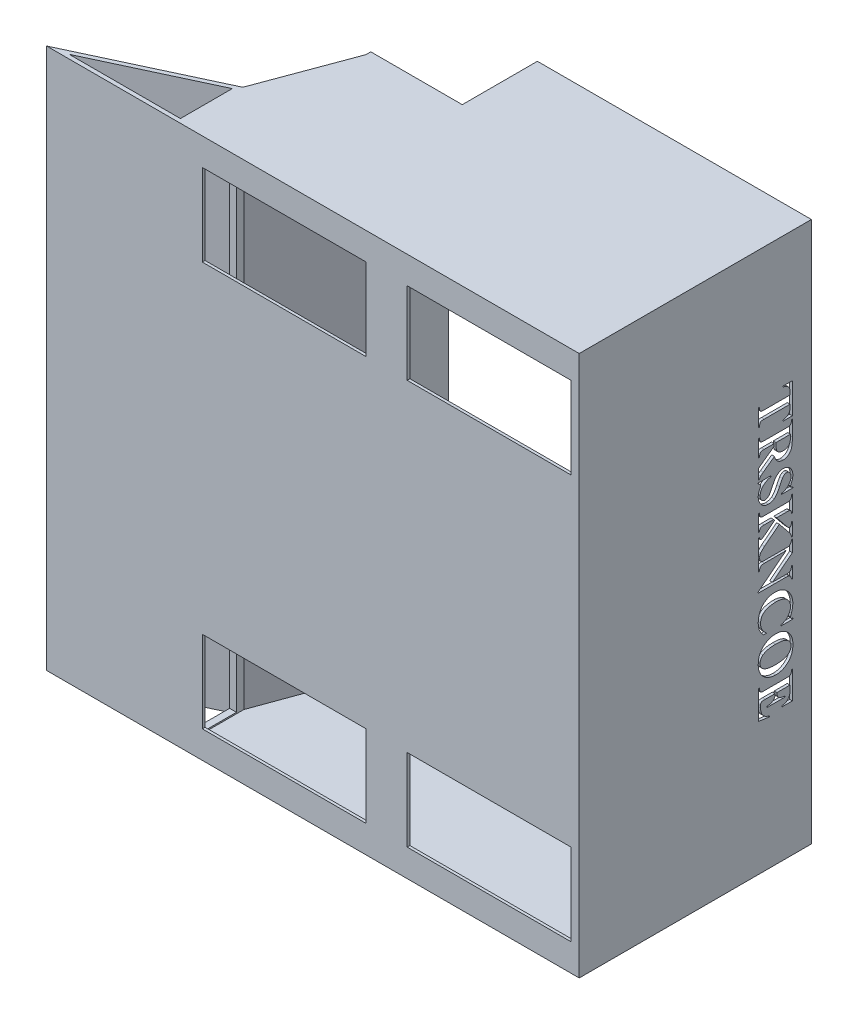
from build123d import *

# Parameters (mm, degrees)
BOSS_EXTRUDE2_DEPTH  = 198
SKETCH5_W            = 60
SKETCH5_H            = 30
CUT_EXTRUDE5_DEPTH   = 33
BOSS_EXTRUDE5_DEPTH  = 198
BOSS_EXTRUDE6_DEPTH  = 1.5
BOSS_EXTRUDE7_DEPTH  = 1.5
SKETCH12_W           = 10
SKETCH12_H           = 30
CUT_EXTRUDE8_DEPTH   = 2.5
SKETCH13_W           = 133.813801543
SKETCH13_H           = 25
CUT_EXTRUDE9_DEPTH   = 200
CUT_EXTRUDE13_DEPTH  = 301
SKETCH20_W           = 18
SKETCH20_H           = 194
CUT_EXTRUDE14_DEPTH  = 3
CUT_EXTRUDE16_DEPTH  = 10
CUT_EXTRUDE17_DEPTH  = 29
BOSS_EXTRUDE8_DEPTH  = 29
BOSS_EXTRUDE10_DEPTH = 1.5
SKETCH27_W           = 10
SKETCH27_H           = 30
CUT_EXTRUDE18_DEPTH  = 1.5
SKETCH29_W           = 10
SKETCH29_H           = 30
CUT_EXTRUDE19_DEPTH  = 1.5


with BuildPart() as part:
    # Sketch1 → Boss-Extrude2 (new body)
    with BuildSketch(Plane(origin=(0, 0, 0), x_dir=(1, 0, 0), z_dir=(0, 1, 0))):
        Polygon((-61.934971554, -72.496387141), (-16.445680057, -51.284382152), (-4.2594816, -17.803077062), (-4.2594816, 36.503612859), (-5.2594816, 36.503612859), (-5.2594816, -17.803077062), (-17.445680057, -50.647311892), (-66.445680057, -73.496387141), (128.554319943, -73.496387141), (128.554319943, 36.503612859), (127.554319943, 35.503612859), (127.554319943, -72.496387141), align=None)
    extrude(amount=BOSS_EXTRUDE2_DEPTH)

    # Sketch5 → Cut-Extrude5 (cut)
    with BuildSketch(Plane(origin=(0, 0, 72.496387141), x_dir=(-1, 0, 0), z_dir=(0, 0, -1))):
        with Locations((-95.554319943, 173)):
            Rectangle(SKETCH5_W, SKETCH5_H)
        with Locations((-20.554319943, 173)):
            Rectangle(SKETCH5_W, SKETCH5_H)
        with Locations((-95.554319943, 25)):
            Rectangle(SKETCH5_W, SKETCH5_H)
        with Locations((-20.554319943, 25)):
            Rectangle(SKETCH5_W, SKETCH5_H)
    extrude(amount=-CUT_EXTRUDE5_DEPTH, mode=Mode.SUBTRACT)

    # Sketch8 → Boss-Extrude5 (add)
    with BuildSketch(Plane(origin=(0, 0, 0), x_dir=(-1, 0, 0), z_dir=(0, -1, 0))):
        Polygon((16.445680057, -51.284382152), (16.445680057, -72.496387141), (61.934971554, -72.496387141), align=None)
    extrude(amount=-BOSS_EXTRUDE5_DEPTH)

    # Sketch10 → Boss-Extrude6 (add)
    with BuildSketch(Plane(origin=(0, 198, 0), x_dir=(1, 0, 0), z_dir=(0, 1, 0))):
        Polygon((127.554319943, -72.496387141), (127.554319943, 35.503612859), (128.554319943, 36.503612859), (-4.2594816, 36.503612859), (-4.2594816, -17.803077062), (-16.445680057, -51.284382152), (-16.445680057, -72.496387141), align=None)
    extrude(amount=-BOSS_EXTRUDE6_DEPTH)

    # Sketch11 → Boss-Extrude7 (add)
    with BuildSketch(Plane(origin=(0, 0, 0), x_dir=(-1, 0, 0), z_dir=(0, -1, 0))):
        Polygon((4.2594816, 36.503612859), (4.2594816, -17.803077062), (16.445680057, -51.284382152), (16.445680057, -72.496387141), (-127.554319943, -72.496387141), (-127.554319943, 35.503612859), (-128.554319943, 36.503612859), align=None)
    extrude(amount=-BOSS_EXTRUDE7_DEPTH)

    # Sketch12 → Cut-Extrude8 (cut)
    with BuildSketch(Plane.ZY.offset(5.2594816)):
        with Locations((11.496387141, 99)):
            Rectangle(SKETCH12_W, SKETCH12_H)
    extrude(amount=-CUT_EXTRUDE8_DEPTH, mode=Mode.SUBTRACT)

    # Sketch13 → Cut-Extrude9 (cut)
    with BuildSketch(Plane(origin=(0, 198, 0), x_dir=(1, 0, 0), z_dir=(0, 1, 0))):
        with Locations((61.647419171, 24.003612859)):
            Rectangle(SKETCH13_W, SKETCH13_H)
    extrude(amount=-CUT_EXTRUDE9_DEPTH, mode=Mode.SUBTRACT)

    # Sketch19 → Cut-Extrude13 (cut)
    with BuildSketch(Plane(origin=(0, 0, 0), x_dir=(-1, 0, 0), z_dir=(0, -1, 0))):
        Polygon((59.679617302, -71.996387141), (18.945680057, -71.996387141), (18.945680057, -53.001840257), align=None)
    extrude(amount=-CUT_EXTRUDE13_DEPTH, mode=Mode.SUBTRACT)

    # Sketch20 → Cut-Extrude14 (cut)
    with BuildSketch(Plane(origin=(-16.445680057, 0, 0), x_dir=(0, 0, -1), z_dir=(1, 0, 0))):
        with Locations((-62.996387141, 99)):
            Rectangle(SKETCH20_W, SKETCH20_H)
    extrude(amount=-CUT_EXTRUDE14_DEPTH, mode=Mode.SUBTRACT)

    # Sketch22 → Cut-Extrude16 (cut)
    # profile 1 of 8: a face of its own
    with BuildSketch(Plane(origin=(128.554319943, 0, 0), x_dir=(0, 0, -1), z_dir=(1, 0, 0))):
        with BuildLine():
            Line((4.532708535, 139.23699273), (1.108283622, 139.23699273))
            Line((1.108283622, 139.23699273), (1.108283622, 139.579435221))
            add(Edge.make_bspline(
                [(1.108283622, 139.579435221), (1.283727047, 139.625369692), (1.6114492, 139.711173669), (2.057569025, 139.862804818), (2.427571695, 140.017409192), (2.725039365, 140.190704227), (2.971397315, 140.385135725), (3.179215664, 140.61055841), (3.367807428, 140.862653524), (3.466009727, 141.051094846), (3.516082389, 141.147179752)],
                knots=[0, 0, 0, 0, 1.456789678, 2.721231939, 3.783509113, 4.673258435, 5.479000225, 6.295157497, 7.130712789, 8, 8, 8, 8], degree=3))
            add(Edge.make_bspline(
                [(3.516082389, 141.147179752), (3.541258402, 141.212592895), (3.598476255, 141.361258197), (3.642844061, 141.626322478), (3.671328394, 141.951760613), (3.674743728, 142.189565138), (3.676602307, 142.318975152)],
                knots=[0, 0, 0, 0, 0.705326227, 1.603004102, 2.695587181, 4, 4, 4, 4], degree=3))
            Line((3.676602307, 142.318975152), (3.676602307, 143.346302626))
            Line((3.676602307, 143.346302626), (-5.740566204, 143.346302626))
            add(Edge.make_bspline(
                [(-5.740566204, 143.346302626), (-5.812795026, 143.345263702), (-5.951011668, 143.343275623), (-6.147327182, 143.342748047), (-6.322070378, 143.333435506), (-6.47579109, 143.324581732), (-6.6074858, 143.307088211), (-6.719653643, 143.292810872), (-6.809273737, 143.272254265), (-6.901428046, 143.240225155), (-6.996317414, 143.180939376), (-7.103429506, 143.095281356), (-7.198567805, 142.98021221), (-7.287981424, 142.843159412), (-7.36289385, 142.679725819), (-7.416270639, 142.487661246), (-7.447237148, 142.269155551), (-7.450874242, 142.113970885), (-7.452778661, 142.032714632)],
                knots=[0, 0, 0, 0, 1.352332734, 2.587815859, 3.674093584, 4.62800279, 5.468700902, 6.160453175, 6.743556292, 7.187132044, 7.980238029, 8.822426595, 9.745903759, 10.759998733, 11.880501272, 13.095856917, 14.479361463, 16, 16, 16, 16], degree=3))
            Line((-7.452778661, 142.032714632), (-7.452778661, 141.634090169))
            Line((-7.452778661, 141.634090169), (-7.795221152, 141.634090169))
            Line((-7.795221152, 141.634090169), (-7.795221152, 147.969276259))
            Line((-7.795221152, 147.969276259), (-7.452778661, 147.969276259))
            Line((-7.452778661, 147.969276259), (-7.452778661, 147.567976464))
            add(Edge.make_bspline(
                [(-7.452778661, 147.567976464), (-7.451177078, 147.484002318), (-7.448128564, 147.324162761), (-7.413192523, 147.097706397), (-7.355965173, 146.896125346), (-7.296697088, 146.777143385), (-7.268180755, 146.719896232)],
                knots=[0, 0, 0, 0, 1.147815573, 2.184795468, 3.126629849, 4, 4, 4, 4], degree=3))
            add(Edge.make_bspline(
                [(-7.268180755, 146.719896232), (-7.245527744, 146.682261264), (-7.199705916, 146.606134388), (-7.101704377, 146.508668436), (-6.984268883, 146.423026842), (-6.894407147, 146.378810209), (-6.848153637, 146.356051085)],
                knots=[0, 0, 0, 0, 0.928829741, 1.878808762, 2.908183361, 4, 4, 4, 4], degree=3))
            add(Edge.make_bspline(
                [(-6.848153637, 146.356051085), (-6.82696283, 146.347312771), (-6.778691025, 146.327407246), (-6.692125509, 146.312607489), (-6.586754108, 146.291147537), (-6.45853416, 146.280318282), (-6.308770082, 146.269393816), (-6.138385377, 146.260878411), (-5.946560431, 146.259985379), (-5.811905735, 146.258075597), (-5.740566204, 146.257063802)],
                knots=[0, 0, 0, 0, 0.491154816, 1.118830903, 1.878082211, 2.802823963, 3.878617243, 5.106317376, 6.466938293, 8, 8, 8, 8], degree=3))
            Line((-5.740566204, 146.257063802), (3.676602307, 146.257063802))
            Line((3.676602307, 146.257063802), (3.676602307, 147.284391276))
            add(Edge.make_bspline(
                [(3.676602307, 147.284391276), (3.675209474, 147.382541865), (3.672533176, 147.571135998), (3.648051684, 147.843749081), (3.608486076, 148.095994854), (3.553386758, 148.328099904), (3.48140098, 148.540398485), (3.389593011, 148.729432323), (3.286819616, 148.901505483), (3.201857304, 148.999473778), (3.160263238, 149.04743504)],
                knots=[0, 0, 0, 0, 1.253047779, 2.407702914, 3.491633713, 4.510764096, 5.450666339, 6.347071276, 7.190793839, 8, 8, 8, 8], degree=3))
            add(Edge.make_bspline(
                [(3.160263238, 149.04743504), (3.098232731, 149.110379856), (2.973774304, 149.23667276), (2.762057505, 149.401886271), (2.534663557, 149.55260774), (2.286649074, 149.684671003), (2.018692926, 149.795052717), (1.733365207, 149.892947914), (1.428181165, 149.97042517), (1.216486, 150.005833286), (1.108283622, 150.023931207)],
                knots=[0, 0, 0, 0, 0.914922114, 1.835705892, 2.776354923, 3.739610741, 4.741925865, 5.776441286, 6.863486844, 8, 8, 8, 8], degree=3))
            Line((1.108283622, 150.023931207), (1.108283622, 150.366373698))
            Line((1.108283622, 150.366373698), (4.532708535, 150.366373698))
            Line((4.532708535, 150.366373698), (4.532708535, 139.23699273))
        make_face()
    # profile 2 of 8: a face of its own
    with BuildSketch(Plane(origin=(128.554319943, 0, 0), x_dir=(0, 0, -1), z_dir=(1, 0, 0))):
        with BuildLine():
            Line((-2.144920045, 133.757912869), (-5.740566204, 133.757912869))
            add(Edge.make_bspline(
                [(-5.740566204, 133.757912869), (-5.814587919, 133.757254909), (-5.956407099, 133.755994315), (-6.15796856, 133.750541404), (-6.338260564, 133.743466374), (-6.496325162, 133.730608761), (-6.63283574, 133.711807615), (-6.748005293, 133.690584459), (-6.842913922, 133.668404638), (-6.93907565, 133.629081364), (-7.039557625, 133.564530452), (-7.145181407, 133.467172514), (-7.236336091, 133.344237703), (-7.317399153, 133.193124852), (-7.384358347, 132.996374977), (-7.419860952, 132.737789677), (-7.451520192, 132.414784285), (-7.452334288, 132.176026219), (-7.452778661, 132.045700412)],
                knots=[0, 0, 0, 0, 1.201644639, 2.3022468, 3.273150526, 4.130331253, 4.875559622, 5.508734867, 6.031899083, 6.453960745, 7.188995541, 7.957346903, 8.773832027, 9.661165858, 10.732433931, 12.127079426, 13.885970896, 16, 16, 16, 16], degree=3))
            Line((-7.452778661, 132.045700412), (-7.795221152, 132.045700412))
            Line((-7.795221152, 132.045700412), (-7.795221152, 138.209665256))
            Line((-7.795221152, 138.209665256), (-7.452778661, 138.209665256))
            add(Edge.make_bspline(
                [(-7.452778661, 138.209665256), (-7.452218331, 138.078479095), (-7.451194973, 137.838887048), (-7.42095196, 137.513601944), (-7.380902403, 137.254992361), (-7.316230896, 137.056530211), (-7.230596591, 136.908983813), (-7.13923606, 136.787745008), (-7.034503841, 136.691788675), (-6.935877857, 136.625686063), (-6.840965293, 136.58747001), (-6.747232609, 136.564467922), (-6.633030656, 136.542723787), (-6.495919734, 136.529337867), (-6.338491698, 136.510419896), (-6.157920856, 136.505300804), (-5.956420986, 136.499232626), (-5.814592682, 136.498063183), (-5.740566204, 136.497452799)],
                knots=[0, 0, 0, 0, 2.130193463, 3.890482125, 5.302978532, 6.375097578, 7.257445176, 8.06306665, 8.83202836, 9.555418243, 9.977815174, 10.487376127, 11.121054341, 11.86504307, 12.724249415, 13.695924388, 14.797400823, 16, 16, 16, 16], degree=3))
            Line((-5.740566204, 136.497452799), (2.478053588, 136.497452799))
            add(Edge.make_bspline(
                [(2.478053588, 136.497452799), (2.552080184, 136.498062767), (2.693908715, 136.499231411), (2.895407053, 136.505304979), (3.075982774, 136.510406905), (3.233395722, 136.529377955), (3.370552171, 136.542603712), (3.485469006, 136.564978814), (3.580404921, 136.586924022), (3.676564575, 136.626299495), (3.777020067, 136.690841835), (3.882769989, 136.788145764), (3.972938255, 136.910695928), (4.056448067, 137.060671146), (4.12026207, 137.258699147), (4.162228776, 137.516967267), (4.187357733, 137.840864952), (4.189238887, 138.079412351), (4.190266044, 138.209665256)],
                knots=[0, 0, 0, 0, 1.201515742, 2.301999846, 3.272799427, 4.131231703, 4.874550165, 5.507657491, 6.030765589, 6.452781978, 7.18773793, 7.956006874, 8.772404417, 9.64691745, 10.731773378, 12.128746246, 13.88619766, 16, 16, 16, 16], degree=3))
            Line((4.190266044, 138.209665256), (4.532708535, 138.209665256))
            Line((4.532708535, 138.209665256), (4.532708535, 132.50585751))
            add(Edge.make_bspline(
                [(4.532708535, 132.50585751), (4.531484518, 132.326604095), (4.5291153, 131.979639786), (4.516601993, 131.478291984), (4.492824315, 131.014383431), (4.458710796, 130.587827226), (4.413242605, 130.198895961), (4.360955549, 129.845991868), (4.29720921, 129.531749445), (4.225017741, 129.249727188), (4.137291993, 128.993467249), (4.036167095, 128.751234727), (3.915931874, 128.522833637), (3.780330643, 128.305292831), (3.628557155, 128.100171262), (3.458673395, 127.905884271), (3.271685321, 127.725296681), (3.07121296, 127.556367577), (2.85836136, 127.403475629), (2.632438526, 127.273241304), (2.399777158, 127.159530504), (2.156685727, 127.068691796), (1.905559841, 126.995990516), (1.644164075, 126.945097704), (1.373816297, 126.915783317), (1.190397407, 126.911321067), (1.097582294, 126.909063043)],
                knots=[0, 0, 0, 0, 1.726483433, 3.341794804, 4.829708898, 6.19992401, 7.462396709, 8.600599068, 9.634857001, 10.549418861, 11.402289802, 12.241382758, 13.0750512, 13.88534005, 14.708186664, 15.529911836, 16.368125147, 17.209413191, 18.053109236, 18.888368986, 19.718134714, 20.544470446, 21.384486037, 22.233455642, 23.106078906, 24, 24, 24, 24], degree=3))
            add(Edge.make_bspline(
                [(1.097582294, 126.909063043), (0.985071758, 126.91226052), (0.764460915, 126.918530139), (0.440568627, 126.964549958), (0.132423, 127.042536194), (-0.16179332, 127.14902856), (-0.438833355, 127.290403481), (-0.702899565, 127.459846545), (-0.95286794, 127.660317326), (-1.103114244, 127.815219033), (-1.179125207, 127.893585205)],
                knots=[0, 0, 0, 0, 1.055875917, 2.070363217, 3.063103869, 4.034981426, 5.000784238, 5.975972407, 6.976026164, 8, 8, 8, 8], degree=3))
            add(Edge.make_bspline(
                [(-1.179125207, 127.893585205), (-1.272100997, 128.005989439), (-1.465054968, 128.239263533), (-1.689867872, 128.656952967), (-1.887612315, 129.129865905), (-1.982861985, 129.472511558), (-2.032556103, 129.651278305)],
                knots=[0, 0, 0, 0, 0.885719489, 1.838146155, 2.87210716, 4, 4, 4, 4], degree=3))
            Line((-2.032556103, 129.651278305), (-6.128489339, 126.684335158))
            add(Edge.make_bspline(
                [(-6.128489339, 126.684335158), (-6.19284906, 126.639064874), (-6.316736874, 126.551922849), (-6.490886464, 126.424403554), (-6.648337797, 126.309373987), (-6.783868431, 126.202021483), (-6.901908169, 126.107060804), (-6.999450292, 126.019802792), (-7.078904404, 125.944757808), (-7.123078837, 125.895360176), (-7.142440153, 125.873709573)],
                knots=[0, 0, 0, 0, 1.451918146, 2.794837519, 3.982947617, 5.049517129, 5.985027272, 6.777632289, 7.464245587, 8, 8, 8, 8], degree=3))
            add(Edge.make_bspline(
                [(-7.142440153, 125.873709573), (-7.186586527, 125.811708767), (-7.274586021, 125.688119013), (-7.366769331, 125.478967971), (-7.430913443, 125.257428826), (-7.445419536, 125.103645547), (-7.452778661, 125.02562934)],
                knots=[0, 0, 0, 0, 0.994168701, 1.981733386, 2.976107756, 4, 4, 4, 4], degree=3))
            Line((-7.452778661, 125.02562934), (-7.795221152, 125.02562934))
            Line((-7.795221152, 125.02562934), (-7.795221152, 128.819250064))
            Line((-7.795221152, 128.819250064), (-2.144920045, 132.909832637))
            Line((-2.144920045, 132.909832637), (-2.144920045, 133.757912869))
        make_face()
        with BuildLine():
            Line((3.847823553, 133.757912869), (-1.460035063, 133.757912869))
            Line((-1.460035063, 133.757912869), (-1.460035063, 133.21482048))
            add(Edge.make_bspline(
                [(-1.460035063, 133.21482048), (-1.459744782, 133.107799135), (-1.45918341, 132.900830989), (-1.448558621, 132.600146102), (-1.429531706, 132.320989794), (-1.406196529, 132.062096866), (-1.374932563, 131.824481365), (-1.333770944, 131.607045052), (-1.290514188, 131.409780819), (-1.219444055, 131.178893226), (-1.106051828, 130.917501129), (-0.921829557, 130.636501034), (-0.687646466, 130.39461193), (-0.411356227, 130.18494468), (-0.086939507, 130.018233862), (0.283956309, 129.902206597), (0.698139288, 129.832602951), (0.988497103, 129.824213084), (1.140387606, 129.819824219)],
                knots=[0, 0, 0, 0, 1.034149226, 1.999937005, 2.906794707, 3.737712964, 4.511620493, 5.221514996, 5.875829492, 6.461890401, 7.553881478, 8.617484609, 9.690230081, 10.791566161, 11.955549912, 13.195557958, 14.532954548, 16, 16, 16, 16], degree=3))
            add(Edge.make_bspline(
                [(1.140387606, 129.819824219), (1.251947192, 129.821731832), (1.468420627, 129.825433419), (1.781435774, 129.858039829), (2.072997563, 129.909809372), (2.340964164, 129.988782476), (2.588412435, 130.083706088), (2.813518536, 130.201200019), (3.011678899, 130.345395953), (3.192584611, 130.506772634), (3.347720781, 130.696284065), (3.483044468, 130.911113527), (3.597825281, 131.151482507), (3.687743385, 131.4197771), (3.759349386, 131.712474869), (3.813390244, 132.030598281), (3.84134376, 132.37604571), (3.845607387, 132.614609619), (3.847823553, 132.738611391)],
                knots=[0, 0, 0, 0, 1.164130753, 2.258912866, 3.281299513, 4.250478917, 5.170069284, 6.044502933, 6.891761094, 7.722026402, 8.568210108, 9.438472197, 10.366923691, 11.341274467, 12.386541005, 13.509761723, 14.705613267, 16, 16, 16, 16], degree=3))
            Line((3.847823553, 132.738611391), (3.847823553, 133.757912869))
        make_face(mode=Mode.SUBTRACT)
    # profile 3 of 8: a face of its own
    with BuildSketch(Plane(origin=(128.554319943, 0, 0), x_dir=(0, 0, -1), z_dir=(1, 0, 0))):
        with BuildLine():
            Line((4.703929781, 116.293345812), (0.594619885, 116.293345812))
            Line((0.594619885, 116.293345812), (0.594619885, 116.635788303))
            add(Edge.make_bspline(
                [(0.594619885, 116.635788303), (0.720842095, 116.660503273), (0.968421699, 116.708980656), (1.326651295, 116.815557966), (1.666976699, 116.943143338), (1.988567103, 117.095593822), (2.291178769, 117.272652606), (2.571316989, 117.478524448), (2.83911438, 117.701608502), (3.079616961, 117.95437978), (3.299642124, 118.21740786), (3.491439156, 118.490687724), (3.655316073, 118.767187179), (3.787088281, 119.051802462), (3.892980037, 119.339375127), (3.964016012, 119.634901615), (4.012748088, 119.933737755), (4.01694696, 120.135820591), (4.019044798, 120.236785126)],
                knots=[0, 0, 0, 0, 1.144647834, 2.245179015, 3.323223498, 4.378092962, 5.410336142, 6.439551446, 7.47048058, 8.509329745, 9.541236932, 10.521538389, 11.478900123, 12.398951312, 13.310707536, 14.20236123, 15.101864541, 16, 16, 16, 16], degree=3))
            add(Edge.make_bspline(
                [(4.019044798, 120.236785126), (4.01420831, 120.386242065), (4.004955281, 120.672178704), (3.912601342, 121.077276459), (3.760775018, 121.43501561), (3.546187187, 121.733734593), (3.301193938, 121.979746675), (3.025249872, 122.153625176), (2.730912154, 122.26718974), (2.525435928, 122.279755835), (2.421871616, 122.28608941)],
                knots=[0, 0, 0, 0, 1.240386588, 2.373071298, 3.43189099, 4.447686075, 5.412023421, 6.298205506, 7.142260017, 8, 8, 8, 8], degree=3))
            add(Edge.make_bspline(
                [(2.421871616, 122.28608941), (2.35746479, 122.283402797), (2.230228379, 122.278095363), (2.045741637, 122.239609577), (1.870325639, 122.179193637), (1.765501027, 122.116762386), (1.712908646, 122.085439512)],
                knots=[0, 0, 0, 0, 1.034510543, 2.043687212, 3.018482926, 4, 4, 4, 4], degree=3))
            add(Edge.make_bspline(
                [(1.712908646, 122.085439512), (1.641979803, 122.034494991), (1.493599782, 121.92792129), (1.287237899, 121.724546487), (1.081865311, 121.481454954), (0.955125568, 121.298283601), (0.888906401, 121.202579965)],
                knots=[0, 0, 0, 0, 0.861243433, 1.801683407, 2.851420335, 4, 4, 4, 4], degree=3))
            add(Edge.make_bspline(
                [(0.888906401, 121.202579965), (0.861732469, 121.160026158), (0.800378904, 121.063947766), (0.708348104, 120.896504817), (0.598775617, 120.694487724), (0.475628147, 120.455470481), (0.339223948, 120.179853715), (0.190839229, 119.866604407), (0.023520981, 119.519023802), (-0.089730283, 119.27383403), (-0.149122401, 119.145249685)],
                knots=[0, 0, 0, 0, 0.525425385, 1.186310459, 1.987890453, 2.917855787, 3.984737341, 5.188781275, 6.525718604, 8, 8, 8, 8], degree=3))
            add(Edge.make_bspline(
                [(-0.149122401, 119.145249685), (-0.233403314, 118.964463071), (-0.395384648, 118.617005317), (-0.649814687, 118.127079732), (-0.900216033, 117.687078817), (-1.148996943, 117.299053495), (-1.391094436, 116.959128641), (-1.633233127, 116.671966863), (-1.867627723, 116.428721066), (-2.038008244, 116.302090199), (-2.118166726, 116.242514504)],
                knots=[0, 0, 0, 0, 1.351302326, 2.59709756, 3.739211266, 4.780014725, 5.719093837, 6.563872535, 7.324348837, 8, 8, 8, 8], degree=3))
            add(Edge.make_bspline(
                [(-2.118166726, 116.242514504), (-2.196787731, 116.191352859), (-2.352333357, 116.090133468), (-2.598069716, 115.960222979), (-2.853590913, 115.854864704), (-3.115305188, 115.76222713), (-3.387426532, 115.692343806), (-3.667704649, 115.645710952), (-3.956330417, 115.614823363), (-4.151338011, 115.61060424), (-4.250406301, 115.608460829)],
                knots=[0, 0, 0, 0, 0.996344776, 1.971191697, 2.947878822, 3.930751197, 4.918952808, 5.928367894, 6.947563805, 8, 8, 8, 8], degree=3))
            add(Edge.make_bspline(
                [(-4.250406301, 115.608460829), (-4.375457247, 115.611996855), (-4.622390984, 115.618979322), (-4.985060892, 115.676281025), (-5.333093737, 115.771778669), (-5.670222714, 115.898915119), (-5.991262692, 116.070351442), (-6.30229719, 116.273946827), (-6.595531111, 116.519934689), (-6.875324025, 116.796015038), (-7.131425989, 117.101339913), (-7.353014438, 117.43260835), (-7.546123926, 117.780989048), (-7.696739397, 118.153015067), (-7.818859223, 118.541911372), (-7.902683288, 118.951609773), (-7.959269824, 119.380878398), (-7.96401856, 119.674774391), (-7.966442398, 119.824784003)],
                knots=[0, 0, 0, 0, 0.958291041, 1.89230385, 2.806082205, 3.721470248, 4.648022591, 5.590379525, 6.566357341, 7.576687834, 8.600801837, 9.615217942, 10.627858716, 11.64859008, 12.686507178, 13.748417553, 14.85075326, 16, 16, 16, 16], degree=3))
            add(Edge.make_bspline(
                [(-7.966442398, 119.824784003), (-7.959515651, 120.011568467), (-7.945926008, 120.378022492), (-7.860944071, 120.833706654), (-7.748910255, 121.200636621), (-7.630403529, 121.504961003), (-7.491198457, 121.845094079), (-7.378342719, 122.078023073), (-7.319012063, 122.200478787)],
                knots=[0, 0, 0, 0, 1.351813776, 2.652134936, 3.340338297, 4.126880753, 5.015261474, 6, 6, 6, 6], degree=3))
            add(Edge.make_bspline(
                [(-7.319012063, 122.200478787), (-7.287745474, 122.268742876), (-7.228868229, 122.397289085), (-7.160482045, 122.583386147), (-7.120091104, 122.752558809), (-7.113452244, 122.859327743), (-7.110336169, 122.909441757)],
                knots=[0, 0, 0, 0, 1.209867191, 2.278267276, 3.191872249, 4, 4, 4, 4], degree=3))
            add(Edge.make_bspline(
                [(-7.110336169, 122.909441757), (-7.112918776, 122.949938136), (-7.118207039, 123.03286036), (-7.163540506, 123.155751478), (-7.22725151, 123.283326029), (-7.322608627, 123.410268824), (-7.44132692, 123.536447481), (-7.591250822, 123.648545361), (-7.767121196, 123.749098294), (-7.897876428, 123.800254905), (-7.966442398, 123.827080621)],
                knots=[0, 0, 0, 0, 0.729660239, 1.494085464, 2.344550278, 3.301897717, 4.35052023, 5.465754661, 6.671081929, 8, 8, 8, 8], degree=3))
            Line((-7.966442398, 123.827080621), (-7.966442398, 124.169523112))
            Line((-7.966442398, 124.169523112), (-3.343468765, 124.169523112))
            Line((-3.343468765, 124.169523112), (-3.343468765, 123.827080621))
            add(Edge.make_bspline(
                [(-3.343468765, 123.827080621), (-3.499260025, 123.791985316), (-3.804792961, 123.723157505), (-4.242826745, 123.5821391), (-4.653324845, 123.422144225), (-5.036213016, 123.241211747), (-5.387923987, 123.030804465), (-5.712209325, 122.798417086), (-6.008771115, 122.542536374), (-6.275803744, 122.265781844), (-6.507918997, 121.971127636), (-6.717407993, 121.674138619), (-6.891248847, 121.36829455), (-7.034103186, 121.056941415), (-7.144887876, 120.739886266), (-7.221567471, 120.417049633), (-7.272589059, 120.089474133), (-7.278561331, 119.86867036), (-7.281557415, 119.757900704)],
                knots=[0, 0, 0, 0, 1.248177424, 2.447886446, 3.593885666, 4.691755401, 5.754906139, 6.794118607, 7.807629517, 8.813700699, 9.796001908, 10.738024902, 11.653105301, 12.542423343, 13.413511193, 14.274379661, 15.134315643, 16, 16, 16, 16], degree=3))
            add(Edge.make_bspline(
                [(-7.281557415, 119.757900704), (-7.280414104, 119.673973036), (-7.278169958, 119.50923573), (-7.248995885, 119.270051837), (-7.211802217, 119.041654128), (-7.148412333, 118.829631797), (-7.074188034, 118.628058956), (-6.98004457, 118.441086056), (-6.870034762, 118.266262917), (-6.744734295, 118.105495155), (-6.605940203, 117.964030909), (-6.464712124, 117.835160075), (-6.313482746, 117.730976166), (-6.157044022, 117.6452165), (-5.996804765, 117.574057517), (-5.82945808, 117.525616802), (-5.6566806, 117.499305541), (-5.539999048, 117.494381727), (-5.481059004, 117.491894531)],
                knots=[0, 0, 0, 0, 1.249018628, 2.451634478, 3.584857822, 4.690348991, 5.741117778, 6.780494637, 7.801120851, 8.813330994, 9.808938483, 10.749712525, 11.656014895, 12.535752804, 13.404190857, 14.261591593, 15.121867454, 16, 16, 16, 16], degree=3))
            add(Edge.make_bspline(
                [(-5.481059004, 117.491894531), (-5.410373464, 117.495200354), (-5.268463905, 117.501837184), (-5.058583786, 117.549169258), (-4.852927537, 117.625330947), (-4.650531028, 117.73106035), (-4.452186124, 117.867690705), (-4.261437357, 118.039696014), (-4.075111244, 118.24074772), (-3.922527147, 118.432178044), (-3.801816874, 118.61076289), (-3.69841937, 118.768880177), (-3.593564918, 118.953154718), (-3.480685631, 119.160281114), (-3.360512309, 119.390518872), (-3.232651078, 119.643638391), (-3.097605486, 119.920433612), (-3.00946665, 120.114387955), (-2.963571626, 120.21538247)],
                knots=[0, 0, 0, 0, 0.866176238, 1.738950961, 2.624437821, 3.548628761, 4.531180078, 5.56892973, 6.690538131, 7.889160655, 8.565403501, 9.332647179, 10.204599823, 11.163510307, 12.224665009, 13.388324697, 14.640067153, 16, 16, 16, 16], degree=3))
            add(Edge.make_bspline(
                [(-2.963571626, 120.21538247), (-2.897946603, 120.356454263), (-2.77125619, 120.628796167), (-2.581942277, 121.02024003), (-2.396968143, 121.378185248), (-2.221632893, 121.704468913), (-2.052685162, 121.996921184), (-1.892345966, 122.256696548), (-1.740762956, 122.485683113), (-1.546583627, 122.742673286), (-1.300998958, 123.023524398), (-0.991672906, 123.321604465), (-0.664741088, 123.576848626), (-0.319821299, 123.790364406), (0.04218082, 123.960709846), (0.423431246, 124.081624706), (0.82266555, 124.156299693), (1.095471378, 124.165069231), (1.234024225, 124.169523112)],
                knots=[0, 0, 0, 0, 1.21684471, 2.349142924, 3.400350116, 4.367770799, 5.245837419, 6.041327541, 6.755115338, 7.392585805, 8.559141946, 9.669051427, 10.747485349, 11.796561776, 12.835597848, 13.867870391, 14.917132273, 16, 16, 16, 16], degree=3))
            add(Edge.make_bspline(
                [(1.234024225, 124.169523112), (1.351910477, 124.166655), (1.585243986, 124.160978117), (1.928112218, 124.109315278), (2.256546567, 124.022374582), (2.57311244, 123.905881627), (2.872170382, 123.746607216), (3.164544688, 123.564155049), (3.436575841, 123.33845427), (3.695309746, 123.086086896), (3.931287776, 122.807756898), (4.13921596, 122.509089188), (4.3142713, 122.19171785), (4.454903405, 121.855594361), (4.569988933, 121.503759821), (4.644843833, 121.131932693), (4.695361913, 120.743811281), (4.701041936, 120.478624848), (4.703929781, 120.343798404)],
                knots=[0, 0, 0, 0, 0.981847001, 1.94338018, 2.880574158, 3.809394485, 4.746588464, 5.698889787, 6.676029961, 7.684891324, 8.707667174, 9.711480907, 10.712513109, 11.721374473, 12.743583337, 13.791398059, 14.877099631, 16, 16, 16, 16], degree=3))
            add(Edge.make_bspline(
                [(4.703929781, 120.343798404), (4.697663198, 120.145038009), (4.685230509, 119.750704134), (4.599369883, 119.365649628), (4.556786523, 119.174678336)],
                knots=[0, 0, 0, 0, 1.008081772, 2, 2, 2, 2], degree=3))
            add(Edge.make_bspline(
                [(4.556786523, 119.174678336), (4.535579734, 119.098524015), (4.490672097, 118.937259119), (4.396127281, 118.688727063), (4.285361124, 118.414157557), (4.14941353, 118.133459096), (4.020781717, 117.863577997), (3.927011288, 117.625284146), (3.863601339, 117.432603389), (3.852529513, 117.316510619), (3.847823553, 117.267166646)],
                knots=[0, 0, 0, 0, 0.928527003, 1.96625494, 3.122285487, 4.406882625, 5.630707087, 6.632955341, 7.418952494, 8, 8, 8, 8], degree=3))
            add(Edge.make_bspline(
                [(3.847823553, 117.267166646), (3.848750141, 117.229465305), (3.85054727, 117.156343063), (3.881866458, 117.054032836), (3.927212991, 116.962945514), (3.99656826, 116.881176662), (4.105679505, 116.811674705), (4.260882613, 116.751777368), (4.464093692, 116.686670657), (4.618800375, 116.653848907), (4.703929781, 116.635788303)],
                knots=[0, 0, 0, 0, 0.766660426, 1.486947879, 2.162833624, 2.834290511, 3.64732928, 4.773396713, 6.224518702, 8, 8, 8, 8], degree=3))
            Line((4.703929781, 116.635788303), (4.703929781, 116.293345812))
        make_face()
    # profile 4 of 8: a face of its own
    with BuildSketch(Plane(origin=(128.554319943, 0, 0), x_dir=(0, 0, -1), z_dir=(1, 0, 0))):
        with BuildLine():
            Line((-0.240083687, 107.237347115), (-5.665656909, 102.972867966))
            add(Edge.make_bspline(
                [(-5.665656909, 102.972867966), (-5.755378953, 102.898587925), (-5.928797396, 102.755016419), (-6.171159767, 102.536835603), (-6.395595734, 102.332317236), (-6.592904858, 102.130662384), (-6.77029709, 101.938509787), (-6.925453434, 101.753643203), (-7.061120415, 101.578530079), (-7.136161575, 101.459220031), (-7.171868805, 101.402448103)],
                knots=[0, 0, 0, 0, 1.279150578, 2.472394666, 3.58129678, 4.613259786, 5.569919014, 6.452784954, 7.263780525, 8, 8, 8, 8], degree=3))
            add(Edge.make_bspline(
                [(-7.171868805, 101.402448103), (-7.215051892, 101.322304341), (-7.300027114, 101.164598296), (-7.38909462, 100.912553622), (-7.440646186, 100.653680837), (-7.448729178, 100.478790559), (-7.452778661, 100.391172621)],
                knots=[0, 0, 0, 0, 1.02798654, 2.022861021, 3.009477012, 4, 4, 4, 4], degree=3))
            Line((-7.452778661, 100.391172621), (-7.795221152, 100.391172621))
            Line((-7.795221152, 100.391172621), (-7.795221152, 106.672852071))
            Line((-7.795221152, 106.672852071), (-7.452778661, 106.672852071))
            add(Edge.make_bspline(
                [(-7.452778661, 106.672852071), (-7.44373862, 106.580737131), (-7.427415195, 106.414406974), (-7.383394784, 106.193085215), (-7.338484422, 106.020874751), (-7.271856013, 105.898479582), (-7.195695139, 105.815483864), (-7.112267764, 105.761100939), (-7.022556131, 105.722761194), (-6.958236156, 105.719437745), (-6.925738264, 105.71775856)],
                knots=[0, 0, 0, 0, 1.844895798, 3.331292491, 4.502006909, 5.378125489, 6.083073103, 6.724546566, 7.355572691, 8, 8, 8, 8], degree=3))
            add(Edge.make_bspline(
                [(-6.925738264, 105.71775856), (-6.890781993, 105.721194754), (-6.81137382, 105.72900056), (-6.682846626, 105.768627573), (-6.536247294, 105.838648591), (-6.367678295, 105.930103332), (-6.177541735, 106.044886437), (-5.968648168, 106.189357616), (-5.736262137, 106.356189836), (-5.577751695, 106.481333589), (-5.494435664, 106.547111469)],
                knots=[0, 0, 0, 0, 0.503234185, 1.143168494, 1.916404061, 2.832650554, 3.895018605, 5.101969321, 6.476741256, 8, 8, 8, 8], degree=3))
            Line((-5.494435664, 106.547111469), (-1.94694548, 109.334807375))
            Line((-1.94694548, 109.334807375), (-2.321491955, 109.789613809))
            Line((-2.321491955, 109.789613809), (-5.740566204, 109.789613809))
            add(Edge.make_bspline(
                [(-5.740566204, 109.789613809), (-5.814580748, 109.788592778), (-5.955476995, 109.786649115), (-6.155330517, 109.785885456), (-6.332834852, 109.777254692), (-6.488864397, 109.766288685), (-6.624079847, 109.755207162), (-6.736038924, 109.734893806), (-6.827227486, 109.718126129), (-6.918874701, 109.686560001), (-7.014854343, 109.630843225), (-7.117723296, 109.54671056), (-7.211999765, 109.440034376), (-7.300346658, 109.310032095), (-7.370052187, 109.144235006), (-7.41993246, 108.939631578), (-7.446808385, 108.693432475), (-7.450695037, 108.515326169), (-7.452778661, 108.419843843)],
                knots=[0, 0, 0, 0, 1.347058548, 2.564299976, 3.636483145, 4.579968604, 5.411587257, 6.102583623, 6.650038075, 7.096541507, 7.859450963, 8.655306792, 9.505714382, 10.44191413, 11.503110387, 12.758692781, 14.262343654, 16, 16, 16, 16], degree=3))
            Line((-7.452778661, 108.419843843), (-7.795221152, 108.419843843))
            Line((-7.795221152, 108.419843843), (-7.795221152, 114.412587441))
            Line((-7.795221152, 114.412587441), (-7.452778661, 114.412587441))
            Line((-7.452778661, 114.412587441), (-7.452778661, 114.008612315))
            add(Edge.make_bspline(
                [(-7.452778661, 114.008612315), (-7.451209877, 113.924628621), (-7.448223795, 113.76477089), (-7.4127346, 113.537590061), (-7.356530518, 113.334801725), (-7.296756381, 113.215087389), (-7.268180755, 113.15785675)],
                knots=[0, 0, 0, 0, 1.144467932, 2.17842344, 3.129177061, 4, 4, 4, 4], degree=3))
            add(Edge.make_bspline(
                [(-7.268180755, 113.15785675), (-7.245499509, 113.120258384), (-7.19962057, 113.044205544), (-7.102436523, 112.946530075), (-6.983970368, 112.863757616), (-6.894346125, 112.821263703), (-6.848153637, 112.799362267)],
                knots=[0, 0, 0, 0, 0.93343552, 1.888125192, 2.911536119, 4, 4, 4, 4], degree=3))
            add(Edge.make_bspline(
                [(-6.848153637, 112.799362267), (-6.82696283, 112.790623954), (-6.778691025, 112.770718428), (-6.692125509, 112.755918672), (-6.586754108, 112.73445872), (-6.45853416, 112.723629465), (-6.308770082, 112.712704998), (-6.138385377, 112.704189594), (-5.946560431, 112.703296562), (-5.811905735, 112.70138678), (-5.740566204, 112.700374985)],
                knots=[0, 0, 0, 0, 0.491154816, 1.118830903, 1.878082211, 2.802823963, 3.878617243, 5.106317376, 6.466938293, 8, 8, 8, 8], degree=3))
            Line((-5.740566204, 112.700374985), (2.478053588, 112.700374985))
            add(Edge.make_bspline(
                [(2.478053588, 112.700374985), (2.550284419, 112.701398718), (2.688504907, 112.703357727), (2.884794533, 112.704080966), (3.059619694, 112.712774007), (3.21210546, 112.723470331), (3.344601077, 112.735145849), (3.454730073, 112.755257024), (3.545345998, 112.771229697), (3.636084866, 112.804895771), (3.73524375, 112.858513744), (3.839758725, 112.949376552), (3.936309478, 113.063450958), (4.025339554, 113.20096064), (4.100998781, 113.364968881), (4.152650977, 113.556584309), (4.185233034, 113.773855197), (4.188523371, 113.927327995), (4.190266044, 114.008612315)],
                knots=[0, 0, 0, 0, 1.353963977, 2.590937397, 3.678525439, 4.633585292, 5.456840327, 6.168525469, 6.732370981, 7.176481794, 7.976852204, 8.830756602, 9.755347706, 10.770665926, 11.892520065, 13.125421506, 14.477527201, 16, 16, 16, 16], degree=3))
            Line((4.190266044, 114.008612315), (4.190266044, 114.412587441))
            Line((4.190266044, 114.412587441), (4.532708535, 114.412587441))
            Line((4.532708535, 114.412587441), (4.532708535, 108.419843843))
            Line((4.532708535, 108.419843843), (4.190266044, 108.419843843))
            add(Edge.make_bspline(
                [(4.190266044, 108.419843843), (4.188437908, 108.513593472), (4.18499558, 108.690121398), (4.154099152, 108.937026679), (4.100772223, 109.150054686), (4.041471124, 109.272229362), (4.013694135, 109.329456711)],
                knots=[0, 0, 0, 0, 1.201526873, 2.26244144, 3.186117189, 4, 4, 4, 4], degree=3))
            add(Edge.make_bspline(
                [(4.013694135, 109.329456711), (3.990750192, 109.365956159), (3.944264239, 109.439906466), (3.851039272, 109.538216993), (3.734876679, 109.620822833), (3.646984071, 109.663357664), (3.601693012, 109.685275862)],
                knots=[0, 0, 0, 0, 0.931911833, 1.888115301, 2.911745858, 4, 4, 4, 4], degree=3))
            add(Edge.make_bspline(
                [(3.601693012, 109.685275862), (3.580464066, 109.6938526), (3.5311122, 109.713791321), (3.443392348, 109.732303345), (3.334855241, 109.752634951), (3.204818057, 109.76284009), (3.053552842, 109.778514834), (2.881193824, 109.785417434), (2.686731675, 109.786804426), (2.55028786, 109.788641336), (2.478053588, 109.789613809)],
                knots=[0, 0, 0, 0, 0.48390216, 1.124948653, 1.891577582, 2.82144338, 3.88286303, 5.111292714, 6.470698944, 8, 8, 8, 8], degree=3))
            Line((2.478053588, 109.789613809), (-1.270086493, 109.789613809))
            Line((-1.270086493, 109.789613809), (2.360338981, 105.332510757))
            add(Edge.make_bspline(
                [(2.360338981, 105.332510757), (2.4203351, 105.25794797), (2.53419575, 105.116442692), (2.705792458, 104.923846199), (2.864872842, 104.758496852), (3.019017176, 104.626387558), (3.162387409, 104.52134922), (3.296476746, 104.443200614), (3.424100357, 104.397767167), (3.506888806, 104.389363635), (3.545511041, 104.385443242)],
                knots=[0, 0, 0, 0, 1.476562132, 2.802220026, 3.979670577, 5.014054348, 5.93070149, 6.719305622, 7.402534061, 8, 8, 8, 8], degree=3))
            add(Edge.make_bspline(
                [(3.545511041, 104.385443242), (3.599036018, 104.389836052), (3.705107814, 104.398541395), (3.852334372, 104.478077637), (3.97435332, 104.60753793), (4.034832751, 104.71555608), (4.067200774, 104.773366377)],
                knots=[0, 0, 0, 0, 0.929925583, 1.842856973, 2.845517351, 4, 4, 4, 4], degree=3))
            add(Edge.make_bspline(
                [(4.067200774, 104.773366377), (4.082533447, 104.818564066), (4.120598379, 104.930771957), (4.153726422, 105.142361226), (4.174289703, 105.425815522), (4.184557669, 105.639238256), (4.190266044, 105.75788854)],
                knots=[0, 0, 0, 0, 0.574335195, 1.425845939, 2.568924207, 4, 4, 4, 4], degree=3))
            Line((4.190266044, 105.75788854), (4.532708535, 105.75788854))
            Line((4.532708535, 105.75788854), (4.532708535, 100.928914346))
            Line((4.532708535, 100.928914346), (4.190266044, 100.928914346))
            add(Edge.make_bspline(
                [(4.190266044, 100.928914346), (4.181115305, 101.030771513), (4.163853416, 101.222914161), (4.115732331, 101.493389986), (4.051720752, 101.729602464), (3.973666117, 101.908077472), (3.893483218, 102.054451633), (3.803447727, 102.189489552), (3.688339405, 102.355325178), (3.546372753, 102.551255531), (3.373660302, 102.775096143), (3.17753593, 103.031589384), (2.950868894, 103.316167185), (2.790292619, 103.515164072), (2.705456804, 103.620298301)],
                knots=[0, 0, 0, 0, 1.171733222, 2.210349342, 3.145470417, 3.969585266, 4.436223068, 5.057155357, 5.828416858, 6.750542085, 7.830004291, 9.069004903, 10.451493816, 12, 12, 12, 12], degree=3))
            Line((2.705456804, 103.620298301), (-0.240083687, 107.237347115))
        make_face()
    # profile 5 of 8: a face of its own
    with BuildSketch(Plane(origin=(128.554319943, 0, 0), x_dir=(0, 0, -1), z_dir=(1, 0, 0))):
        with BuildLine():
            Line((4.532708535, 95.843108283), (-2.762921729, 90.096495226))
            Line((-2.762921729, 90.096495226), (2.135611096, 90.096495226))
            add(Edge.make_bspline(
                [(2.135611096, 90.096495226), (2.226586835, 90.09768814), (2.400614872, 90.099970073), (2.649751107, 90.112530475), (2.875854373, 90.135985727), (3.079336348, 90.171107483), (3.260384044, 90.212299394), (3.418290739, 90.263274578), (3.554423115, 90.323258164), (3.63177966, 90.376267704), (3.668576311, 90.40148307)],
                knots=[0, 0, 0, 0, 1.377260043, 2.634569015, 3.77505553, 4.815953677, 5.759019958, 6.582959687, 7.325947932, 8, 8, 8, 8], degree=3))
            add(Edge.make_bspline(
                [(3.668576311, 90.40148307), (3.711558461, 90.438730149), (3.797649678, 90.51333429), (3.908479948, 90.646269089), (3.999431157, 90.797279113), (4.071961548, 90.965874933), (4.127670753, 91.151754586), (4.167700125, 91.35505133), (4.188516319, 91.576398533), (4.189667947, 91.729299028), (4.190266044, 91.808707682)],
                knots=[0, 0, 0, 0, 0.876036587, 1.754659902, 2.655600339, 3.585565811, 4.577428142, 5.642743129, 6.775761992, 8, 8, 8, 8], degree=3))
            Line((4.190266044, 91.808707682), (4.532708535, 91.808707682))
            Line((4.532708535, 91.808707682), (4.532708535, 87.528176541))
            Line((4.532708535, 87.528176541), (4.190266044, 87.528176541))
            add(Edge.make_bspline(
                [(4.190266044, 87.528176541), (4.174290374, 87.655109234), (4.145118013, 87.886894596), (4.080072804, 88.198362445), (4.014282733, 88.44424689), (3.935929857, 88.632893369), (3.834745945, 88.777138088), (3.71129324, 88.894952103), (3.565951815, 89.001116217), (3.386464648, 89.08943504), (3.161531844, 89.159634735), (2.877557599, 89.207628904), (2.528523499, 89.234745353), (2.273891069, 89.238402797), (2.135611096, 89.240388997)],
                knots=[0, 0, 0, 0, 1.473283143, 2.690287717, 3.66261777, 4.403260528, 5.030300982, 5.676899707, 6.361247918, 7.096383431, 7.970383986, 9.066655204, 10.407026004, 12, 12, 12, 12], degree=3))
            Line((2.135611096, 89.240388997), (-7.966442398, 89.240388997))
            Line((-7.966442398, 89.240388997), (-7.966442398, 89.633662796))
            Line((-7.966442398, 89.633662796), (2.191793067, 97.630230035))
            Line((2.191793067, 97.630230035), (-5.740566204, 97.630230035))
            add(Edge.make_bspline(
                [(-5.740566204, 97.630230035), (-5.820848073, 97.628267752), (-5.975389263, 97.624490393), (-6.197441371, 97.607646846), (-6.398827702, 97.572824674), (-6.579695332, 97.524566511), (-6.741905846, 97.464850382), (-6.881047559, 97.386080492), (-7.003059887, 97.297491676), (-7.13130348, 97.157920119), (-7.260382943, 96.967585505), (-7.371801859, 96.719443929), (-7.441501573, 96.455091253), (-7.448993106, 96.272477079), (-7.452778661, 96.180200111)],
                knots=[0, 0, 0, 0, 1.127320391, 2.17007198, 3.122984334, 3.991487975, 4.795914076, 5.541283944, 6.229819547, 6.902815781, 8.19103919, 9.440541263, 10.706677101, 12, 12, 12, 12], degree=3))
            Line((-7.452778661, 96.180200111), (-7.452778661, 95.918017578))
            Line((-7.452778661, 95.918017578), (-7.795221152, 95.918017578))
            Line((-7.795221152, 95.918017578), (-7.795221152, 100.19854872))
            Line((-7.795221152, 100.19854872), (-7.452778661, 100.19854872))
            add(Edge.make_bspline(
                [(-7.452778661, 100.19854872), (-7.450928938, 100.121816315), (-7.447374432, 99.974364016), (-7.428991649, 99.761578613), (-7.398184587, 99.566209762), (-7.351413003, 99.389828795), (-7.299741042, 99.22998988), (-7.232860802, 99.089216511), (-7.151250779, 98.96791953), (-7.059937372, 98.861260409), (-6.951975123, 98.770949753), (-6.828751641, 98.693455953), (-6.687084444, 98.62936852), (-6.530298387, 98.576357678), (-6.356289118, 98.536532605), (-6.166689458, 98.508031677), (-5.959462545, 98.488270946), (-5.81552593, 98.486998784), (-5.740566204, 98.486336263)],
                knots=[0, 0, 0, 0, 1.302254148, 2.502467739, 3.622024049, 4.653421555, 5.596190003, 6.46934253, 7.287800068, 8.07079221, 8.843923894, 9.666846287, 10.533548967, 11.476317415, 12.471093534, 13.558375583, 14.728443775, 16, 16, 16, 16], degree=3))
            Line((-5.740566204, 98.486336263), (3.275302513, 98.486336263))
            Line((3.275302513, 98.486336263), (3.459900418, 98.633479521))
            add(Edge.make_bspline(
                [(3.459900418, 98.633479521), (3.527912747, 98.694744117), (3.655993767, 98.810117787), (3.817961548, 98.988334845), (3.945299339, 99.15365214), (4.040025973, 99.31553131), (4.102203493, 99.491986441), (4.151230871, 99.691490529), (4.177582283, 99.924172473), (4.185881979, 100.08970727), (4.190266044, 100.177146064)],
                knots=[0, 0, 0, 0, 1.235122191, 2.325985793, 3.245786458, 4.049174235, 4.845312707, 5.762193488, 6.817945803, 8, 8, 8, 8], degree=3))
            Line((4.190266044, 100.177146064), (4.532708535, 100.177146064))
            Line((4.532708535, 100.177146064), (4.532708535, 95.843108283))
        make_face()
    # profile 6 of 8: a face of its own
    with BuildSketch(Plane(origin=(128.554319943, 0, 0), x_dir=(0, 0, -1), z_dir=(1, 0, 0))):
        with BuildLine():
            Line((4.703929781, 74.686583116), (0.42339864, 74.686583116))
            Line((0.42339864, 74.686583116), (0.42339864, 75.029025608))
            add(Edge.make_bspline(
                [(0.42339864, 75.029025608), (0.557800846, 75.06439758), (0.822387476, 75.134031489), (1.200512952, 75.272004696), (1.557517004, 75.42678041), (1.888671275, 75.605759688), (2.196589169, 75.806981912), (2.476844783, 76.032962184), (2.736779287, 76.276993577), (2.968153281, 76.54440011), (3.173002086, 76.827549409), (3.353108018, 77.119823156), (3.507602144, 77.421638551), (3.632286199, 77.733410968), (3.730724377, 78.054473454), (3.794959426, 78.384657625), (3.841393795, 78.723244488), (3.845663228, 78.952681955), (3.847823553, 79.068776872)],
                knots=[0, 0, 0, 0, 1.161811191, 2.287162664, 3.362539583, 4.41377175, 5.431556306, 6.434474661, 7.421063397, 8.40967995, 9.386863755, 10.341150071, 11.278467461, 12.218895573, 13.146188527, 14.082347873, 15.029671706, 16, 16, 16, 16], degree=3))
            add(Edge.make_bspline(
                [(3.847823553, 79.068776872), (3.845601647, 79.166053522), (3.841208846, 79.35837351), (3.811063078, 79.644579912), (3.761002445, 79.924716071), (3.687891217, 80.197987097), (3.596438492, 80.465549709), (3.484136423, 80.72641027), (3.35253275, 80.982517392), (3.200206231, 81.229375041), (3.033670445, 81.465771739), (2.852340665, 81.686784231), (2.661062663, 81.893312265), (2.453548884, 82.081193042), (2.233851162, 82.251923317), (2.003640558, 82.408802659), (1.758786607, 82.544671706), (1.589416028, 82.624349743), (1.504232753, 82.664423031)],
                knots=[0, 0, 0, 0, 1.02829159, 2.032975312, 3.038940942, 4.033667372, 5.020499735, 6.025669891, 7.033400993, 8.061735798, 9.089724829, 10.088018836, 11.081851371, 12.062902699, 13.043546265, 14.021467076, 15.004916236, 16, 16, 16, 16], degree=3))
            add(Edge.make_bspline(
                [(1.504232753, 82.664423031), (1.391530346, 82.71136767), (1.165026729, 82.80571464), (0.813722802, 82.921115583), (0.454568443, 83.024207703), (0.085809476, 83.107394053), (-0.293332785, 83.167823636), (-0.680718246, 83.212683843), (-1.077824099, 83.244638943), (-1.345823054, 83.246635226), (-1.481437718, 83.247645399)],
                knots=[0, 0, 0, 0, 0.956154332, 1.921630777, 2.894736381, 3.882898921, 4.881013987, 5.90099383, 6.93784654, 8, 8, 8, 8], degree=3))
            add(Edge.make_bspline(
                [(-1.481437718, 83.247645399), (-1.744697151, 83.242455992), (-2.260796721, 83.232282565), (-3.016746527, 83.154092926), (-3.736925033, 83.02332035), (-4.309745135, 82.870524318), (-4.742400846, 82.719547493), (-5.045607916, 82.595228868), (-5.326466899, 82.452492882), (-5.589386897, 82.297767894), (-5.828240535, 82.122329779), (-6.05281661, 81.938756209), (-6.254538342, 81.737158718), (-6.433063744, 81.518796897), (-6.597132302, 81.288942447), (-6.730731956, 81.03792378), (-6.852020008, 80.775097716), (-6.942991554, 80.492262546), (-7.019110564, 80.19501794), (-7.071876283, 79.880035465), (-7.104433341, 79.549245959), (-7.108345513, 79.323010858), (-7.110336169, 79.207894135)],
                knots=[0, 0, 0, 0, 2.006990555, 3.934548346, 5.787009187, 7.583223225, 8.447690095, 9.279838617, 10.079576777, 10.848035224, 11.602896935, 12.336796949, 13.057987776, 13.772739271, 14.485742175, 15.206933002, 15.937360034, 16.689921501, 17.468302894, 18.275378123, 19.12244908, 20, 20, 20, 20], degree=3))
            add(Edge.make_bspline(
                [(-7.110336169, 79.207894135), (-7.104141671, 79.017551889), (-7.09190864, 78.641659835), (-6.995577418, 78.091083924), (-6.840664615, 77.564041509), (-6.655652397, 77.146055912), (-6.474146761, 76.820750273), (-6.311481752, 76.575120939), (-6.130580171, 76.322633337), (-5.923152503, 76.070613321), (-5.698623314, 75.810825834), (-5.446160259, 75.553448746), (-5.172855865, 75.290570499), (-4.980402936, 75.117640038), (-4.881784644, 75.029025608)],
                knots=[0, 0, 0, 0, 1.396476526, 2.757792575, 4.089498632, 5.420094176, 6.102936245, 6.821907575, 7.58133878, 8.381807926, 9.216807735, 10.100981943, 11.026889754, 12, 12, 12, 12], degree=3))
            Line((-4.881784644, 75.029025608), (-5.938540769, 75.029025608))
            add(Edge.make_bspline(
                [(-5.938540769, 75.029025608), (-6.107686407, 75.200827784), (-6.435892514, 75.534188574), (-6.861764438, 76.071022413), (-7.213672647, 76.617814471), (-7.500647641, 77.180506634), (-7.709698094, 77.776834674), (-7.858645227, 78.412631475), (-7.951501349, 79.094582602), (-7.96136878, 79.565191608), (-7.966442398, 79.807168494)],
                knots=[0, 0, 0, 0, 1.080333407, 2.096252823, 3.065566613, 3.991769755, 4.921246319, 5.891013516, 6.915605147, 8, 8, 8, 8], degree=3))
            add(Edge.make_bspline(
                [(-7.966442398, 79.807168494), (-7.963471409, 79.969525595), (-7.957620637, 80.289255701), (-7.923249165, 80.762803639), (-7.861880071, 81.221909658), (-7.775168108, 81.667181291), (-7.669736762, 82.099560188), (-7.535577009, 82.516687587), (-7.376280145, 82.920033199), (-7.196395474, 83.309995707), (-6.989302402, 83.680395888), (-6.766444172, 84.033732847), (-6.514168807, 84.359273708), (-6.248639284, 84.669940089), (-5.954670737, 84.951984698), (-5.644751085, 85.216505863), (-5.310083586, 85.454333749), (-4.959135869, 85.672707697), (-4.593663105, 85.867840028), (-4.218291993, 86.035302864), (-3.838920887, 86.181954934), (-3.451740847, 86.29578356), (-3.060518613, 86.386977454), (-2.664162206, 86.455356995), (-2.260674706, 86.492381736), (-1.989819724, 86.498011611), (-1.853308861, 86.500849067)],
                knots=[0, 0, 0, 0, 1.149895009, 2.264490137, 3.360463465, 4.42817537, 5.475919118, 6.510541489, 7.528548818, 8.545752583, 9.549336433, 10.532177159, 11.501038485, 12.463538698, 13.423798412, 14.382873532, 15.346864517, 16.32830407, 17.30872703, 18.278329138, 19.237820072, 20.186966069, 21.133734647, 22.0817032, 23.033178753, 24, 24, 24, 24], degree=3))
            add(Edge.make_bspline(
                [(-1.853308861, 86.500849067), (-1.709590808, 86.498832905), (-1.424086997, 86.494827687), (-0.99896338, 86.445511003), (-0.578568007, 86.374914992), (-0.163681754, 86.272933406), (0.244746476, 86.14116192), (0.647417056, 85.979315016), (1.045709046, 85.790192241), (1.434551119, 85.570731984), (1.810981233, 85.328187496), (2.168949018, 85.064289437), (2.50500531, 84.779182045), (2.819217768, 84.474624389), (3.107374393, 84.145582833), (3.379779695, 83.801466524), (3.624941584, 83.433248729), (3.849181053, 83.049110208), (4.049683887, 82.651618232), (4.222478997, 82.244227617), (4.374249786, 81.832696003), (4.494344161, 81.413066448), (4.588130114, 80.987729442), (4.654704458, 80.55614344), (4.696396069, 80.118331489), (4.701406457, 79.824204862), (4.703929781, 79.676077228)],
                knots=[0, 0, 0, 0, 0.98451416, 1.955791484, 2.929469707, 3.904892067, 4.881003555, 5.868435137, 6.87723788, 7.900709406, 8.926405041, 9.944698661, 10.94642213, 11.944858433, 12.940728467, 13.942097591, 14.95073368, 15.969669103, 16.989227605, 17.999639919, 19.001195556, 19.993552014, 20.988633984, 21.984466505, 22.984939883, 24, 24, 24, 24], degree=3))
            add(Edge.make_bspline(
                [(4.703929781, 79.676077228), (4.69645103, 79.453707486), (4.681184267, 78.999772599), (4.579011209, 78.310513778), (4.406367815, 77.604074321), (4.245748612, 77.136038383), (4.163512724, 76.896407318)],
                knots=[0, 0, 0, 0, 0.93767989, 1.914134591, 2.932051774, 4, 4, 4, 4], degree=3))
            add(Edge.make_bspline(
                [(4.163512724, 76.896407318), (4.1381876, 76.829653435), (4.089752203, 76.701983745), (4.026543731, 76.518770282), (3.972641993, 76.355678085), (3.929046825, 76.21200591), (3.895080655, 76.086933539), (3.866408588, 75.981535702), (3.852748391, 75.894387806), (3.849319825, 75.843243802), (3.847823553, 75.820923869)],
                knots=[0, 0, 0, 0, 1.524400023, 2.915481001, 4.137857855, 5.192048239, 6.120607735, 6.90571369, 7.522438692, 8, 8, 8, 8], degree=3))
            add(Edge.make_bspline(
                [(3.847823553, 75.820923869), (3.850573787, 75.773437229), (3.856006459, 75.679634544), (3.893989701, 75.543438848), (3.960200989, 75.418949296), (4.049805538, 75.303675143), (4.17013949, 75.203034091), (4.321794372, 75.123980182), (4.502947725, 75.065226279), (4.633992124, 75.041622703), (4.703929781, 75.029025608)],
                knots=[0, 0, 0, 0, 0.886020201, 1.750199074, 2.613736627, 3.502721941, 4.459540153, 5.516891394, 6.674778937, 8, 8, 8, 8], degree=3))
            Line((4.703929781, 75.029025608), (4.703929781, 74.686583116))
        make_face()
    # profile 7 of 8: a face of its own
    with BuildSketch(Plane(origin=(128.554319943, 0, 0), x_dir=(0, 0, -1), z_dir=(1, 0, 0))):
        with BuildLine():
            add(Edge.make_bspline(
                [(4.703929781, 66.719444529), (4.707654881, 66.481203734), (4.714939467, 66.015313999), (4.647705231, 65.331926404), (4.526685404, 64.682909091), (4.344093927, 64.067231288), (4.099586805, 63.487008531), (3.795097389, 62.939427165), (3.430080427, 62.426912818), (3.007348489, 61.955281882), (2.541724413, 61.530407363), (2.044556349, 61.155298877), (1.518583277, 60.838015691), (0.963102849, 60.579941932), (0.379825864, 60.377578616), (-0.232997656, 60.237794217), (-0.873344367, 60.149322036), (-1.309921091, 60.138360123), (-1.532269026, 60.132777235)],
                knots=[0, 0, 0, 0, 1.117610062, 2.185532727, 3.216627967, 4.212526062, 5.193615196, 6.166103508, 7.147549746, 8.140673095, 9.133196434, 10.10178539, 11.059404612, 12.010709147, 12.971743655, 13.951546138, 14.956725216, 16, 16, 16, 16], degree=3))
            add(Edge.make_bspline(
                [(-1.532269026, 60.132777235), (-1.723297973, 60.13675194), (-2.100215227, 60.14459439), (-2.656676452, 60.211039246), (-3.19641219, 60.317252364), (-3.71846635, 60.468255767), (-4.224901479, 60.656859731), (-4.709338145, 60.896167302), (-5.181819565, 61.169003639), (-5.475030837, 61.387196083), (-5.622851598, 61.497196537)],
                knots=[0, 0, 0, 0, 1.04329858, 2.058521712, 3.056960413, 4.045364539, 5.024407242, 6.004903429, 6.994183646, 8, 8, 8, 8], degree=3))
            add(Edge.make_bspline(
                [(-5.622851598, 61.497196537), (-5.718372536, 61.573622687), (-5.907560159, 61.724991402), (-6.171953913, 61.970758713), (-6.42273424, 62.22309005), (-6.649230676, 62.493016699), (-6.861450477, 62.770557762), (-7.055113479, 63.06061746), (-7.228516552, 63.363124618), (-7.384273992, 63.676609812), (-7.520473593, 64.002313073), (-7.642054292, 64.338185192), (-7.739730132, 64.688441406), (-7.823222706, 65.048860463), (-7.887438822, 65.421358225), (-7.931414007, 65.804589038), (-7.963542679, 66.198995675), (-7.965465937, 66.466111828), (-7.966442398, 66.601729923)],
                knots=[0, 0, 0, 0, 1.00627325, 1.9930127, 2.968556301, 3.931628562, 4.889992766, 5.842467438, 6.799060146, 7.757311971, 8.720859362, 9.702647782, 10.694476427, 11.710892394, 12.745970349, 13.802697082, 14.884402792, 16, 16, 16, 16], degree=3))
            add(Edge.make_bspline(
                [(-7.966442398, 66.601729923), (-7.965200473, 66.737331559), (-7.962746785, 67.005241647), (-7.934227032, 67.401488137), (-7.892867296, 67.786490294), (-7.831515105, 68.159946004), (-7.749255786, 68.520643112), (-7.658884541, 68.872432759), (-7.54130814, 69.209717404), (-7.411295465, 69.536153356), (-7.263434947, 69.850848484), (-7.098142643, 70.153430646), (-6.912167814, 70.44261586), (-6.711193562, 70.721204587), (-6.495025189, 70.9898855), (-6.257906995, 71.244316734), (-6.004148463, 71.488142701), (-5.823474649, 71.640355056), (-5.732540208, 71.716964637)],
                knots=[0, 0, 0, 0, 1.124980204, 2.222639447, 3.294760019, 4.33731022, 5.360644311, 6.364012548, 7.349179518, 8.322041904, 9.278700371, 10.232463991, 11.180815654, 12.12962911, 13.081898883, 14.040130074, 15.013583258, 16, 16, 16, 16], degree=3))
            add(Edge.make_bspline(
                [(-5.732540208, 71.716964637), (-5.583715162, 71.831087117), (-5.287717905, 72.058064644), (-4.813028742, 72.349593064), (-4.316426331, 72.593083776), (-3.802616797, 72.799420636), (-3.264928122, 72.952533976), (-2.708836378, 73.065863421), (-2.131475943, 73.134276682), (-1.739345999, 73.141782063), (-1.540295022, 73.145591905)],
                knots=[0, 0, 0, 0, 0.995704132, 1.98035008, 2.952693705, 3.930823669, 4.917222691, 5.917726345, 6.943006999, 8, 8, 8, 8], degree=3))
            add(Edge.make_bspline(
                [(-1.540295022, 73.145591905), (-1.317990101, 73.139834164), (-0.881497837, 73.128528928), (-0.240132155, 73.042484053), (0.370846822, 72.893466539), (0.957157286, 72.694100448), (1.511954837, 72.429346155), (2.040030325, 72.109862707), (2.537492322, 71.729151872), (3.000489558, 71.295553689), (3.425588711, 70.82411016), (3.790130407, 70.316415637), (4.096088104, 69.782450905), (4.339106293, 69.221204365), (4.526665576, 68.63365721), (4.646908458, 68.018797462), (4.714992832, 67.377326264), (4.707666461, 66.941652099), (4.703929781, 66.719444529)],
                knots=[0, 0, 0, 0, 1.060187369, 2.081661461, 3.079308197, 4.055922088, 5.030115251, 6.005459241, 6.994883661, 8.012151107, 9.027379983, 10.0178188, 10.987544273, 11.957167121, 12.929798927, 13.923338458, 14.940837099, 16, 16, 16, 16], degree=3))
        make_face()
        with BuildLine():
            add(Edge.make_bspline(
                [(4.019044798, 66.612431251), (4.014280555, 66.749317533), (4.004976208, 67.01665007), (3.92106858, 67.403855267), (3.790210853, 67.767029493), (3.60336552, 68.104724811), (3.3620143, 68.415551257), (3.065605306, 68.697679462), (2.718540504, 68.956196989), (2.459379142, 69.100755595), (2.325559666, 69.175399272)],
                knots=[0, 0, 0, 0, 1.010272792, 1.973015743, 2.913125299, 3.853904244, 4.812059073, 5.809291075, 6.868814705, 8, 8, 8, 8], degree=3))
            add(Edge.make_bspline(
                [(2.325559666, 69.175399272), (2.204402032, 69.233989085), (1.953637447, 69.355254663), (1.545022659, 69.49514794), (1.101269907, 69.619252773), (0.619572281, 69.720155542), (0.099456252, 69.796309402), (-0.457616424, 69.851544888), (-1.052021446, 69.887461049), (-1.460872216, 69.89071355), (-1.671386288, 69.892388238)],
                knots=[0, 0, 0, 0, 0.787943638, 1.630837067, 2.525905988, 3.487208031, 4.51219802, 5.604605297, 6.766629954, 8, 8, 8, 8], degree=3))
            add(Edge.make_bspline(
                [(-1.671386288, 69.892388238), (-1.9212011, 69.890061537), (-2.404508077, 69.885560158), (-3.1036476, 69.829777884), (-3.75269275, 69.74689291), (-4.35115196, 69.627436327), (-4.900057878, 69.472910485), (-5.398662989, 69.28415668), (-5.849335065, 69.061056338), (-6.116140951, 68.877134616), (-6.246203945, 68.787476137)],
                knots=[0, 0, 0, 0, 1.253361503, 2.424829634, 3.517270749, 4.535371114, 5.484506921, 6.375489106, 7.20808062, 8, 8, 8, 8], degree=3))
            add(Edge.make_bspline(
                [(-6.246203945, 68.787476137), (-6.32909218, 68.721641771), (-6.491100587, 68.592965839), (-6.702012525, 68.368977029), (-6.883003059, 68.128766744), (-7.027990579, 67.86489678), (-7.14395939, 67.584459689), (-7.223808797, 67.283078809), (-7.272910334, 66.963634098), (-7.278630276, 66.743705472), (-7.281557415, 66.631158574)],
                knots=[0, 0, 0, 0, 1.020004059, 1.993639192, 2.958914494, 3.914014926, 4.890155421, 5.879363672, 6.914779566, 8, 8, 8, 8], degree=3))
            add(Edge.make_bspline(
                [(-7.281557415, 66.631158574), (-7.27743012, 66.481693099), (-7.269446619, 66.192579341), (-7.179369954, 65.77969654), (-7.045260967, 65.399978203), (-6.904211928, 65.179818977), (-6.834776977, 65.07144004)],
                knots=[0, 0, 0, 0, 1.086516288, 2.101667992, 3.065498145, 4, 4, 4, 4], degree=3))
            add(Edge.make_bspline(
                [(-6.834776977, 65.07144004), (-6.785003548, 65.006370806), (-6.683850638, 64.874132733), (-6.509690501, 64.688836009), (-6.310120061, 64.5190869), (-6.092631213, 64.357182162), (-5.853352354, 64.207827702), (-5.59389428, 64.067889533), (-5.310781069, 63.943918956), (-5.00850562, 63.824256397), (-4.68182835, 63.721607646), (-4.332312142, 63.629137904), (-3.958415832, 63.556173559), (-3.56108556, 63.495361601), (-3.141091343, 63.443420688), (-2.696535178, 63.409316598), (-2.227998546, 63.391769728), (-1.907720547, 63.387942072), (-1.743620251, 63.385980903)],
                knots=[0, 0, 0, 0, 0.707892346, 1.438626445, 2.192810786, 2.969852605, 3.780430621, 4.628833288, 5.515625217, 6.450403643, 7.437738077, 8.473564391, 9.574142504, 10.728711376, 11.947793638, 13.231341134, 14.581426945, 16, 16, 16, 16], degree=3))
            add(Edge.make_bspline(
                [(-1.743620251, 63.385980903), (-1.550084232, 63.387622421), (-1.175375166, 63.390800598), (-0.632052207, 63.412279485), (-0.126159782, 63.446625427), (0.34263736, 63.493298967), (0.772923484, 63.557110686), (1.165692693, 63.634973275), (1.521587781, 63.722954795), (1.840405746, 63.832309167), (2.129090416, 63.951107859), (2.393663268, 64.07733213), (2.639460932, 64.207103097), (2.860088661, 64.34920489), (3.061369476, 64.496286034), (3.236894194, 64.654825941), (3.3943322, 64.81802085), (3.571240357, 65.046555308), (3.75471802, 65.351796818), (3.905393045, 65.750011648), (4.004766893, 66.172383867), (4.014222832, 66.463817471), (4.019044798, 66.612431251)],
                knots=[0, 0, 0, 0, 1.564404299, 3.028875335, 4.39450989, 5.662661211, 6.836061311, 7.90907002, 8.898638467, 9.796789937, 10.630772472, 11.420758248, 12.165788753, 12.875675156, 13.540309495, 14.178459374, 14.785220426, 15.370668109, 16.511738154, 17.648268039, 18.800756771, 20, 20, 20, 20], degree=3))
        make_face(mode=Mode.SUBTRACT)
    # profile 8 of 8: a face of its own
    with BuildSketch(Plane(origin=(128.554319943, 0, 0), x_dir=(0, 0, -1), z_dir=(1, 0, 0))):
        with BuildLine():
            Line((3.676602307, 54.311254883), (-1.117592571, 54.311254883))
            Line((-1.117592571, 54.311254883), (-1.117592571, 54.070475006))
            add(Edge.make_bspline(
                [(-1.117592571, 54.070475006), (-1.115897157, 53.977615499), (-1.112623627, 53.798321082), (-1.077373206, 53.539096504), (-1.018451081, 53.299797796), (-0.938642139, 53.079582766), (-0.836817175, 52.877394945), (-0.706420561, 52.698189912), (-0.556539636, 52.536048869), (-0.381778423, 52.395146848), (-0.184077914, 52.273441921), (0.033237116, 52.159467985), (0.274449643, 52.062873131), (0.535857945, 51.973599865), (0.818993276, 51.896235524), (1.124877211, 51.833521522), (1.451304355, 51.778694367), (1.67707464, 51.755079344), (1.793168605, 51.742936198)],
                knots=[0, 0, 0, 0, 1.061827254, 2.050190715, 2.985528333, 3.876350441, 4.72504729, 5.565920178, 6.403257757, 7.244563781, 8.124866197, 9.055741834, 10.048518591, 11.093847177, 12.215036816, 13.403597796, 14.664896812, 16, 16, 16, 16], degree=3))
            Line((1.793168605, 51.742936198), (1.793168605, 51.400493707))
            Line((1.793168605, 51.400493707), (-4.71323873, 51.400493707))
            Line((-4.71323873, 51.400493707), (-4.71323873, 51.742936198))
            add(Edge.make_bspline(
                [(-4.71323873, 51.742936198), (-4.542595687, 51.763891769), (-4.214656052, 51.804163921), (-3.748905701, 51.897449101), (-3.333112119, 52.027452041), (-2.965412341, 52.18041896), (-2.650475547, 52.358124723), (-2.388235225, 52.551826207), (-2.181290236, 52.759611967), (-2.027847856, 52.991654427), (-1.922498471, 53.255840778), (-1.853487417, 53.563638299), (-1.807250092, 53.920158118), (-1.804133741, 54.175534773), (-1.802477554, 54.311254883)],
                knots=[0, 0, 0, 0, 1.403308646, 2.696860751, 3.871180936, 4.954242195, 5.94210164, 6.815704658, 7.608525803, 8.323304165, 9.070917025, 9.916716851, 10.892837652, 12, 12, 12, 12], degree=3))
            Line((-1.802477554, 54.311254883), (-5.323214418, 54.311254883))
            add(Edge.make_bspline(
                [(-5.323214418, 54.311254883), (-5.405267944, 54.31187067), (-5.560477883, 54.313035474), (-5.780667373, 54.305305372), (-5.976194826, 54.30289423), (-6.146286242, 54.28975594), (-6.29221459, 54.282194179), (-6.412099977, 54.263719505), (-6.508917259, 54.251454081), (-6.601631004, 54.221703659), (-6.697793703, 54.178369547), (-6.797100785, 54.106191972), (-6.890635197, 54.020926918), (-6.96937278, 53.909962435), (-7.035203771, 53.773284236), (-7.078489333, 53.601741048), (-7.108074032, 53.397327058), (-7.109548916, 53.248387843), (-7.110336169, 53.168888134)],
                knots=[0, 0, 0, 0, 1.553542529, 2.93863354, 4.171798316, 5.254632287, 6.168992463, 6.935602172, 7.551895451, 8.01125334, 8.774321247, 9.537949477, 10.326380249, 11.16067442, 12.097219065, 13.182814534, 14.496262906, 16, 16, 16, 16], degree=3))
            Line((-7.110336169, 53.168888134), (-7.110336169, 52.451899168))
            add(Edge.make_bspline(
                [(-7.110336169, 52.451899168), (-7.107393211, 52.315389234), (-7.101632332, 52.048169327), (-7.067619414, 51.657337759), (-7.007603424, 51.287421409), (-6.916352317, 50.939769752), (-6.81012856, 50.610330755), (-6.671968379, 50.303724172), (-6.510348796, 50.01835927), (-6.326092806, 49.751471317), (-6.111661297, 49.506668791), (-5.87345501, 49.279320342), (-5.60975014, 49.069119116), (-5.318548989, 48.879497383), (-5.002479225, 48.704926799), (-4.659313885, 48.550856048), (-4.290989062, 48.413439635), (-4.034225963, 48.338299592), (-3.902613145, 48.299783961)],
                knots=[0, 0, 0, 0, 1.142947252, 2.237333567, 3.281889435, 4.276051855, 5.244077431, 6.176523046, 7.085936526, 7.986913077, 8.886651342, 9.805516854, 10.740678669, 11.705676228, 12.711517207, 13.760732312, 14.852185807, 16, 16, 16, 16], degree=3))
            Line((-3.902613145, 48.299783961), (-3.902613145, 47.976068793))
            Line((-3.902613145, 47.976068793), (-7.795221152, 48.519161182))
            Line((-7.795221152, 48.519161182), (-7.795221152, 58.934228516))
            Line((-7.795221152, 58.934228516), (-7.452778661, 58.934228516))
            Line((-7.452778661, 58.934228516), (-7.452778661, 58.530253389))
            add(Edge.make_bspline(
                [(-7.452778661, 58.530253389), (-7.451209877, 58.446269696), (-7.448223795, 58.286411965), (-7.4127346, 58.059231136), (-7.356530518, 57.856442799), (-7.296756381, 57.736728463), (-7.268180755, 57.679497825)],
                knots=[0, 0, 0, 0, 1.144467932, 2.17842344, 3.129177061, 4, 4, 4, 4], degree=3))
            add(Edge.make_bspline(
                [(-7.268180755, 57.679497825), (-7.245499509, 57.641899459), (-7.19962057, 57.565846619), (-7.102436523, 57.468171149), (-6.983970368, 57.38539869), (-6.894346125, 57.342904777), (-6.848153637, 57.321003342)],
                knots=[0, 0, 0, 0, 0.93343552, 1.888125192, 2.911536119, 4, 4, 4, 4], degree=3))
            add(Edge.make_bspline(
                [(-6.848153637, 57.321003342), (-6.82696283, 57.312265028), (-6.778691025, 57.292359503), (-6.692125509, 57.277559746), (-6.586754108, 57.256099794), (-6.45853416, 57.245270539), (-6.308770082, 57.234346073), (-6.138385377, 57.225830668), (-5.946560431, 57.224937636), (-5.811905735, 57.223027854), (-5.740566204, 57.222016059)],
                knots=[0, 0, 0, 0, 0.491154816, 1.118830903, 1.878082211, 2.802823963, 3.878617243, 5.106317376, 6.466938293, 8, 8, 8, 8], degree=3))
            Line((-5.740566204, 57.222016059), (2.478053588, 57.222016059))
            add(Edge.make_bspline(
                [(2.478053588, 57.222016059), (2.599343993, 57.222494463), (2.816987799, 57.223352911), (3.104287988, 57.22975958), (3.314359939, 57.243345043), (3.426964797, 57.260751358), (3.470601746, 57.267496702)],
                knots=[0, 0, 0, 0, 1.46329711, 2.625743972, 3.467444458, 4, 4, 4, 4], degree=3))
            add(Edge.make_bspline(
                [(3.470601746, 57.267496702), (3.51956835, 57.283520774), (3.615788169, 57.315008221), (3.743489861, 57.392178347), (3.858286169, 57.48300004), (3.915381858, 57.560306158), (3.944135503, 57.599237866)],
                knots=[0, 0, 0, 0, 1.044833928, 2.053108121, 3.019536498, 4, 4, 4, 4], degree=3))
            add(Edge.make_bspline(
                [(3.944135503, 57.599237866), (3.982299056, 57.659528323), (4.062081505, 57.785567962), (4.135615994, 58.007756079), (4.182079021, 58.25896266), (4.187432745, 58.436367271), (4.190266044, 58.530253389)],
                knots=[0, 0, 0, 0, 0.872932948, 1.824901615, 2.848893824, 4, 4, 4, 4], degree=3))
            Line((4.190266044, 58.530253389), (4.190266044, 58.934228516))
            Line((4.190266044, 58.934228516), (4.532708535, 58.934228516))
            Line((4.532708535, 58.934228516), (4.532708535, 48.832175022))
            Line((4.532708535, 48.832175022), (0.765841131, 48.832175022))
            Line((0.765841131, 48.832175022), (0.765841131, 49.174617513))
            add(Edge.make_bspline(
                [(0.765841131, 49.174617513), (0.872149354, 49.196053022), (1.078540508, 49.237668801), (1.375069054, 49.312175712), (1.647927282, 49.395311494), (1.897333586, 49.482904734), (2.123121969, 49.577087358), (2.327253395, 49.674699477), (2.507849996, 49.781392074), (2.715548784, 49.936418501), (2.945773011, 50.157152015), (3.177713538, 50.47078513), (3.371581206, 50.831699351), (3.465173843, 51.095828258), (3.513407057, 51.231947793)],
                knots=[0, 0, 0, 0, 1.069277221, 2.075938762, 3.013392153, 3.881152597, 4.681366986, 5.42467032, 6.110850156, 6.745755272, 7.977168348, 9.239925466, 10.577588242, 12, 12, 12, 12], degree=3))
            add(Edge.make_bspline(
                [(3.513407057, 51.231947793), (3.526348763, 51.278198698), (3.554514409, 51.378856732), (3.589815232, 51.545609116), (3.61355516, 51.740914102), (3.639745055, 51.962685146), (3.653004408, 52.21195664), (3.667596987, 52.487426314), (3.675150771, 52.7907349), (3.676103768, 53.002123227), (3.676602307, 53.112706163)],
                knots=[0, 0, 0, 0, 0.608728222, 1.324804056, 2.157687748, 3.10140268, 4.154841575, 5.320503916, 6.598283308, 8, 8, 8, 8], degree=3))
            Line((3.676602307, 53.112706163), (3.676602307, 54.311254883))
        make_face()
    extrude(amount=-CUT_EXTRUDE16_DEPTH, mode=Mode.SUBTRACT)


with BuildPart() as cut_extrude16_piece_1:
    # of the separate pieces the step leaves, piece 1, a body of its own (cut_extrude16_pieces)
    add(part.part.solids().sort_by_distance((-16.445680057, 1.5, 72.496387141))[0])

    # Sketch23 → Cut-Extrude17 (cut)
    with BuildSketch(Plane(origin=(0, 0, -11.503612859), x_dir=(-1, 0, 0), z_dir=(0, 0, -1))):
        Polygon((-29.7405184, 0), (5.2594816, 35), (5.2594816, 0), align=None)
        Polygon((5.2594816, 198), (-29.7405184, 198), (5.2594816, 163), align=None)
    extrude(amount=-CUT_EXTRUDE17_DEPTH, mode=Mode.SUBTRACT)

    # Sketch24 → Boss-Extrude8 (add)
    with BuildSketch(Plane(origin=(0, 0, -11.503612859), x_dir=(-1, 0, 0), z_dir=(0, 0, -1))):
        Polygon((-29.7405184, 0), (5.2594816, 35), (5.2594816, 33.5), (-28.2405184, 0), align=None)
        Polygon((-28.2405184, 198), (-29.7405184, 198), (5.2594816, 163), (5.2594816, 164.5), align=None)
    extrude(amount=-BOSS_EXTRUDE8_DEPTH)

    # Sketch26 → Boss-Extrude10 (add)
    with BuildSketch(Plane(origin=(0, 0, 17.496387141), x_dir=(-1, 0, 0), z_dir=(0, 0, -1))):
        Polygon((-28.2405184, 0), (5.2594816, 33.5), (5.2594816, 0), align=None)
        Polygon((-28.2405184, 198), (5.2594816, 198), (5.2594816, 164.5), align=None)
    extrude(amount=BOSS_EXTRUDE10_DEPTH)

    # Sketch27 → Cut-Extrude18 (cut)
    with BuildSketch(Plane(origin=(14.1202592, 14.1202592, 0), x_dir=(0, 0, 1), z_dir=(-0.7071067811865477, -0.7071067811865474, 0))):
        with Locations((9.496387141, 3.719015105)):
            Rectangle(SKETCH27_W, SKETCH27_H)
    extrude(amount=-CUT_EXTRUDE18_DEPTH, mode=Mode.SUBTRACT)

    # Sketch29 → Cut-Extrude19 (cut)
    with BuildSketch(Plane(origin=(-84.8797408, 84.8797408, 0), x_dir=(0, 0, 1), z_dir=(-0.7071067811865479, 0.7071067811865472, 0))):
        with Locations((9.496387141, 136.28812757)):
            Rectangle(SKETCH29_W, SKETCH29_H)
    extrude(amount=-CUT_EXTRUDE19_DEPTH, mode=Mode.SUBTRACT)


with BuildPart() as cut_extrude16_piece_2:
    # of the separate pieces the step leaves, piece 2, a body of its own (cut_extrude16_pieces)
    add(part.part.solids().sort_by_distance((127.554319943, 69.175399272, -2.325559666))[0])


with BuildPart() as cut_extrude16_piece_3:
    # of the separate pieces the step leaves, piece 3, a body of its own (cut_extrude16_pieces)
    add(part.part.solids().sort_by_distance((127.554319943, 132.738611391, -3.847823553))[0])


solid = Compound([cut_extrude16_piece_1.part, cut_extrude16_piece_2.part, cut_extrude16_piece_3.part])
